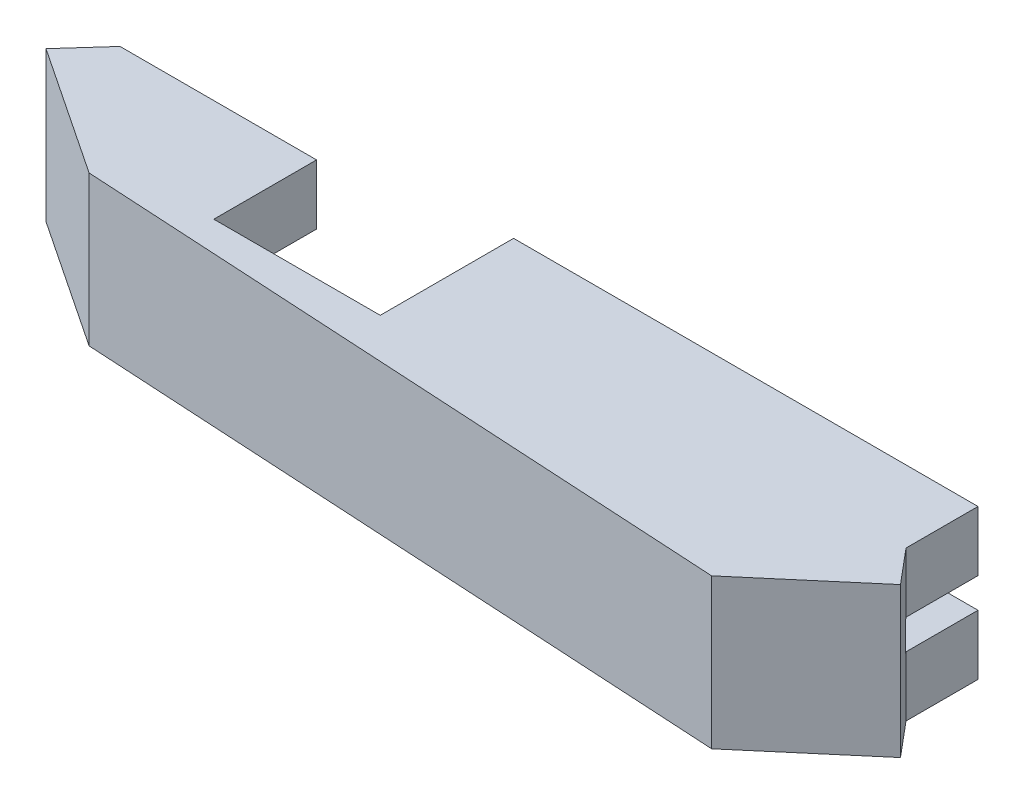
from build123d import *

# Parameters (mm, degrees)
BOSS_EXTRUDE2_DEPTH = 4
BOSS_EXTRUDE3_DEPTH = 2
BOSS_EXTRUDE4_DEPTH = 4


with BuildPart() as part:
    # Sketch2 → Boss-Extrude2 (new body)
    with BuildSketch(Plane(origin=(0, 0, 0), x_dir=(1, 0, 0), z_dir=(0, 1, 0))):
        Polygon((5.5, 6.858588715), (-7.617234461, 6.858588715), (-9.959191583, 4.257581826), (-1.338261213, -1.486289651), (42.73, -4), (49.538362829, 1.796672871), (47.61, 4.0948062), (47.61, 8.9), (16.61, 8.9), (16.61, 0), (5.5, 0), align=None)
    extrude(amount=BOSS_EXTRUDE2_DEPTH)

    # Sketch2<9> → Boss-Extrude3 (add)
    with BuildSketch(Plane(origin=(0, 0, 0), x_dir=(1, 0, 0), z_dir=(0, 1, 0))):
        with BuildLine():
            Line((-0.115159211, -0.3), (-7.817973643, 6.635645268))
            Line((-7.817973643, 6.635645268), (-9.959191583, 4.257581826))
            Line((-9.959191583, 4.257581826), (-1.338261213, -1.486289651))
            Line((-1.338261213, -1.486289651), (42.73, -4))
            Line((42.73, -4), (49.538362829, 1.796672871))
            Line((49.538362829, 1.796672871), (47.802836283, 3.864992867))
            Line((47.802836283, 3.864992867), (42.83919107, -0.3))
            Line((42.83919107, -0.3), (34.16881591, -0.3))
            Line((34.16881591, -0.3), (34.16881591, 0.607570661))
            ThreePointArc((34.16881591, 0.607570661), (29.26, 4.2), (24.35118409, 0.607570661))
            Line((24.35118409, 0.607570661), (24.35118409, -0.3))
            Line((24.35118409, -0.3), (-0.115159211, -0.3))
        make_face()
    extrude(amount=-BOSS_EXTRUDE3_DEPTH)

    # Sketch4 → Boss-Extrude4 (add)
    with BuildSketch(Plane(origin=(0, -2, 0), x_dir=(-1, 0, 0), z_dir=(0, -1, 0))):
        Polygon((7.617234461, 6.858588715), (0, 6.858588715), (0, 0), (-24.15118409, 0), (-24.15118409, 8.9), (-47.61, 8.9), (-47.61, 4.0948062), (-49.538362829, 1.796672871), (-42.73, -4), (1.338261213, -1.486289651), (9.959191583, 4.257581826), align=None)
    extrude(amount=BOSS_EXTRUDE4_DEPTH)


solid = part.part
